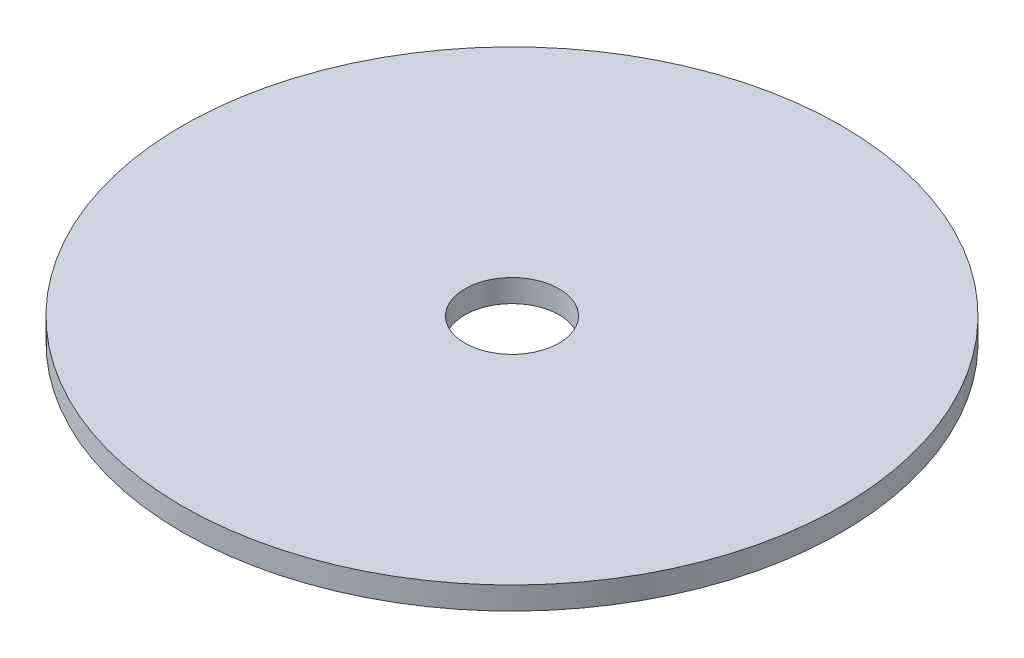
from build123d import *

# Parameters (mm, degrees)
SKETCH1_R           = 87.5
BOSS_EXTRUDE1_DEPTH = 6
SKETCH2_R           = 12.5
CUT_EXTRUDE1_DEPTH  = 124.889063278


with BuildPart() as part:
    # Sketch1 → Boss-Extrude1 (new body)
    with BuildSketch(Plane(origin=(0, 0, 0), x_dir=(1, 0, 0), z_dir=(0, 1, 0))):
        Circle(SKETCH1_R)
    extrude(amount=BOSS_EXTRUDE1_DEPTH)

    # Sketch2 → Cut-Extrude1 (cut, through all)
    with BuildSketch(Plane(origin=(0, 0, 0), x_dir=(1, 0, 0), z_dir=(0, 1, 0))):
        Circle(SKETCH2_R)
    extrude(amount=CUT_EXTRUDE1_DEPTH, mode=Mode.SUBTRACT)


solid = part.part
